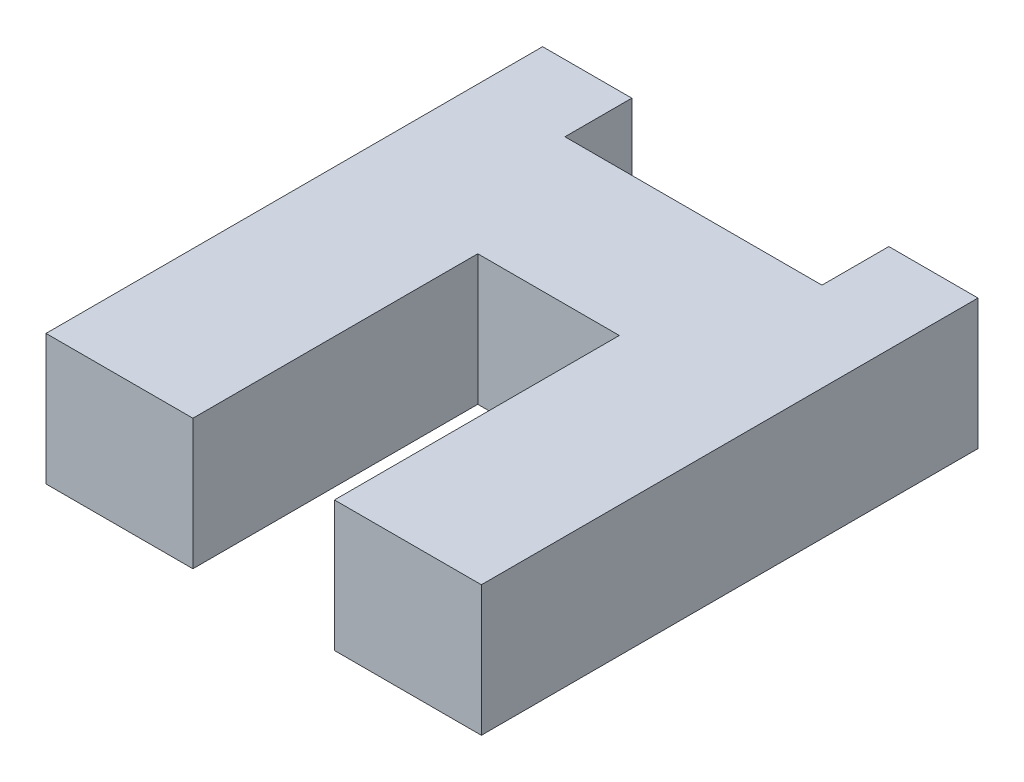
from build123d import *

# Parameters (mm, degrees)
SKETCH1_W           = 19.53
SKETCH1_H           = 19.278
BOSS_EXTRUDE1_DEPTH = 5.85
SKETCH2_W           = 4
SKETCH2_H           = 3
BOSS_EXTRUDE2_DEPTH = 5.85
CAVITY1_START       = -3.175
CAVITY1_OUTLINE_W   = 5.85
CAVITY1_OUTLINE_H   = 12.778
CAVITY1_DEPTH       = 6.35


# Read off the part's stored shape, not the designer's step: Cavity1
with BuildPart() as part:
    # Sketch1 → Boss-Extrude1 (new body)
    with BuildSketch(Plane(origin=(0, 0, 0), x_dir=(1, 0, 0), z_dir=(0, 1, 0))):
        Rectangle(SKETCH1_W, SKETCH1_H)
    extrude(amount=BOSS_EXTRUDE1_DEPTH)

    # Sketch2 → Boss-Extrude2 (add)
    with BuildSketch(Plane(origin=(0, 5.85, 0), x_dir=(1, 0, 0), z_dir=(0, 1, 0))):
        with Locations((-7.765, 11.139)):
            Rectangle(SKETCH2_W, SKETCH2_H)
        with Locations((7.765, 11.139)):
            Rectangle(SKETCH2_W, SKETCH2_H)
    extrude(amount=-BOSS_EXTRUDE2_DEPTH)

    # Cavity1 outline → Cavity1 (cut)
    with BuildSketch(Plane.YZ.offset(CAVITY1_START)):
        with Locations((2.925, 3.25)):
            Rectangle(CAVITY1_OUTLINE_W, CAVITY1_OUTLINE_H)
    extrude(amount=CAVITY1_DEPTH, mode=Mode.SUBTRACT)


solid = part.part
